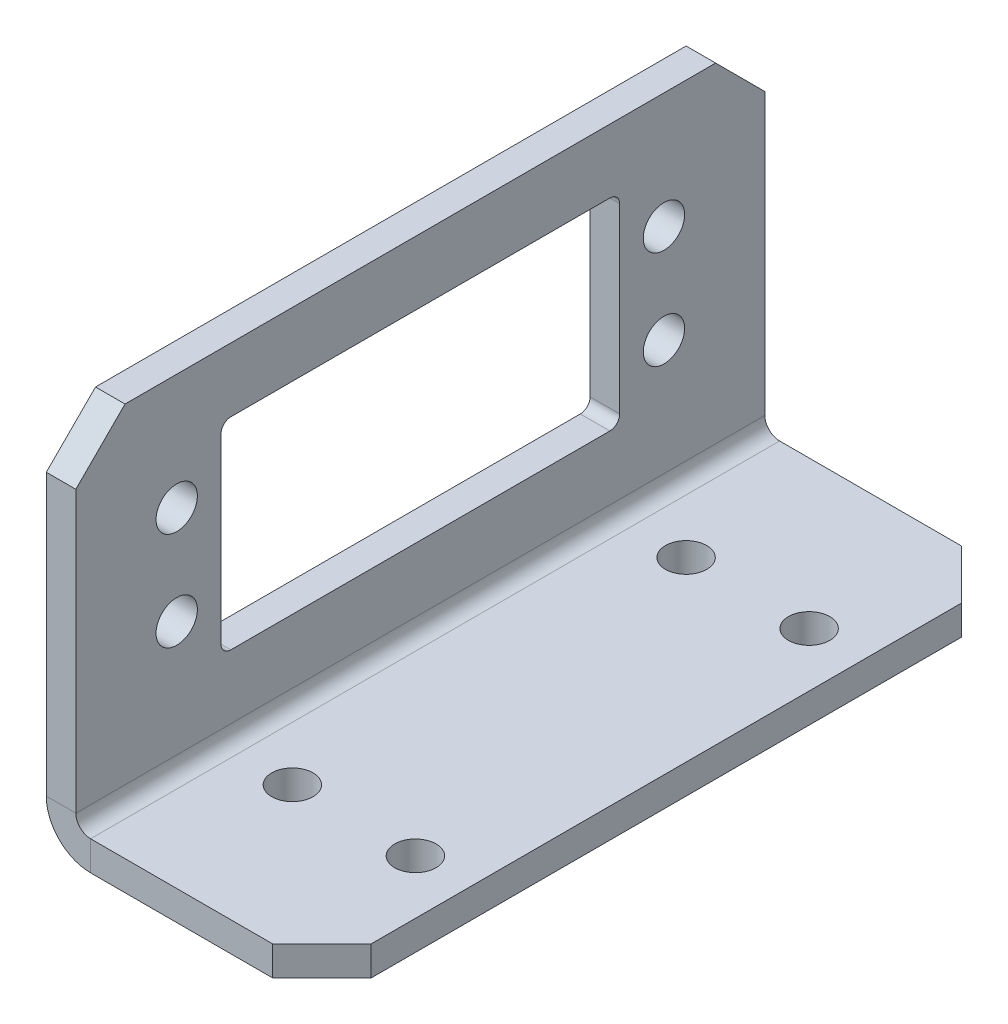
from build123d import *

# Parameters (mm, degrees)
SM_BASE_FLANGE_1_DEPTH = 70
CUT_EXTRUDE_7_REACH    = 79.105
SKETCH_18_W            = 40.5
SKETCH_18_H            = 20.5
CUT_EXTRUDE_8_REACH    = 79.105
SKETCH_19_R            = 2.1
FILLET_2_R             = 1
CUT_EXTRUDE_9_REACH    = 81.783
SKETCH_20_R            = 2.1
CHAMFER_3_SIZE         = 5


# Sheet-metal steps are written as plain solids
with BuildPart() as part:
    # Sketch 1 → 基材-凸緣1 (new body)
    with BuildSketch(Plane.XY):
        with BuildLine():
            Line((-12.5, 17.5), (-12.5, -16))
            ThreePointArc((-12.5, -16), (-12.060660172, -17.060660172), (-11, -17.5))
            Line((-11, -17.5), (12.5, -17.5))
            Line((12.5, -17.5), (12.5, -20.5))
            Line((12.5, -20.5), (-11, -20.5))
            ThreePointArc((-11, -20.5), (-14.181980515, -19.181980515), (-15.5, -16))
            Line((-15.5, -16), (-15.5, 17.5))
            Line((-15.5, 17.5), (-12.5, 17.5))
        make_face()
    extrude(amount=SM_BASE_FLANGE_1_DEPTH)

    # 草圖18 → 除料-伸長7 (cut, up to next)
    with BuildSketch(Plane(origin=(-12.5, 0, 0), x_dir=(0, 0, -1), z_dir=(1, 0, 0)), mode=Mode.PRIVATE) as cut_extrude_7_sk1:
        with Locations((-35, 0.75)):
            Rectangle(SKETCH_18_W, SKETCH_18_H)
    cut_extrude_7_tool1 = extrude(cut_extrude_7_sk1.sketch, amount=-CUT_EXTRUDE_7_REACH, mode=Mode.PRIVATE) & part.part
    add(cut_extrude_7_tool1.solids().sort_by_distance((-12.5, 0.75, 35))[0], mode=Mode.SUBTRACT)

    # 草圖19 → 除料-伸長8 (cut, up to next)
    with BuildSketch(Plane(origin=(-12.5, 0, 0), x_dir=(0, 0, -1), z_dir=(1, 0, 0)), mode=Mode.PRIVATE) as cut_extrude_8_sk1:
        with Locations(Location((-10.25, 5.75, 0), (0, 0, 90))):
            Circle(SKETCH_19_R)
    cut_extrude_8_tool1 = extrude(cut_extrude_8_sk1.sketch, amount=-CUT_EXTRUDE_8_REACH, mode=Mode.PRIVATE) & part.part
    # 草圖19 → 除料-伸長8 (cut, up to next)
    with BuildSketch(Plane(origin=(-12.5, 0, 0), x_dir=(0, 0, -1), z_dir=(1, 0, 0)), mode=Mode.PRIVATE) as cut_extrude_8_sk2:
        with Locations(Location((-10.25, -4.25, 0), (0, 0, 90))):
            Circle(SKETCH_19_R)
    cut_extrude_8_tool2 = extrude(cut_extrude_8_sk2.sketch, amount=-CUT_EXTRUDE_8_REACH, mode=Mode.PRIVATE) & part.part
    # 草圖19 → 除料-伸長8 (cut, up to next)
    with BuildSketch(Plane(origin=(-12.5, 0, 0), x_dir=(0, 0, -1), z_dir=(1, 0, 0)), mode=Mode.PRIVATE) as cut_extrude_8_sk3:
        with Locations(Location((-59.75, -4.25, 0), (0, 0, 90))):
            Circle(SKETCH_19_R)
    cut_extrude_8_tool3 = extrude(cut_extrude_8_sk3.sketch, amount=-CUT_EXTRUDE_8_REACH, mode=Mode.PRIVATE) & part.part
    # 草圖19 → 除料-伸長8 (cut, up to next)
    with BuildSketch(Plane(origin=(-12.5, 0, 0), x_dir=(0, 0, -1), z_dir=(1, 0, 0)), mode=Mode.PRIVATE) as cut_extrude_8_sk4:
        with Locations(Location((-59.75, 5.75, 0), (0, 0, 90))):
            Circle(SKETCH_19_R)
    cut_extrude_8_tool4 = extrude(cut_extrude_8_sk4.sketch, amount=-CUT_EXTRUDE_8_REACH, mode=Mode.PRIVATE) & part.part
    add(cut_extrude_8_tool1.solids().sort_by_distance((-12.5, 5.75, 10.25))[0], mode=Mode.SUBTRACT)
    add(cut_extrude_8_tool2.solids().sort_by_distance((-12.5, -4.25, 10.25))[0], mode=Mode.SUBTRACT)
    add(cut_extrude_8_tool3.solids().sort_by_distance((-12.5, -4.25, 59.75))[0], mode=Mode.SUBTRACT)
    add(cut_extrude_8_tool4.solids().sort_by_distance((-12.5, 5.75, 59.75))[0], mode=Mode.SUBTRACT)

    # 圓角2
    fillet_2_edges = [part.edges().sort_by_distance(p)[0] for p in [
        (-14, 11, 14.75),
        (-14, -9.5, 14.75),
        (-14, -9.5, 55.25),
        (-14, 11, 55.25),
    ]]
    fillet(fillet_2_edges, radius=FILLET_2_R)

    # 草圖20 → 除料-伸長9 (cut, up to next)
    with BuildSketch(Plane(origin=(0, -17.5, 0), x_dir=(1, 0, 0), z_dir=(0, 1, 0)), mode=Mode.PRIVATE) as cut_extrude_9_sk1:
        with Locations(Location((-5.5, -15, 0), (0, 0, 270))):
            Circle(SKETCH_20_R)
    cut_extrude_9_tool1 = extrude(cut_extrude_9_sk1.sketch, amount=-CUT_EXTRUDE_9_REACH, mode=Mode.PRIVATE) & part.part
    # 草圖20 → 除料-伸長9 (cut, up to next)
    with BuildSketch(Plane(origin=(0, -17.5, 0), x_dir=(1, 0, 0), z_dir=(0, 1, 0)), mode=Mode.PRIVATE) as cut_extrude_9_sk2:
        with Locations(Location((7, -15, 0), (0, 0, 270))):
            Circle(SKETCH_20_R)
    cut_extrude_9_tool2 = extrude(cut_extrude_9_sk2.sketch, amount=-CUT_EXTRUDE_9_REACH, mode=Mode.PRIVATE) & part.part
    # 草圖20 → 除料-伸長9 (cut, up to next)
    with BuildSketch(Plane(origin=(0, -17.5, 0), x_dir=(1, 0, 0), z_dir=(0, 1, 0)), mode=Mode.PRIVATE) as cut_extrude_9_sk3:
        with Locations(Location((7, -55, 0), (0, 0, 270))):
            Circle(SKETCH_20_R)
    cut_extrude_9_tool3 = extrude(cut_extrude_9_sk3.sketch, amount=-CUT_EXTRUDE_9_REACH, mode=Mode.PRIVATE) & part.part
    # 草圖20 → 除料-伸長9 (cut, up to next)
    with BuildSketch(Plane(origin=(0, -17.5, 0), x_dir=(1, 0, 0), z_dir=(0, 1, 0)), mode=Mode.PRIVATE) as cut_extrude_9_sk4:
        with Locations(Location((-5.5, -55, 0), (0, 0, 270))):
            Circle(SKETCH_20_R)
    cut_extrude_9_tool4 = extrude(cut_extrude_9_sk4.sketch, amount=-CUT_EXTRUDE_9_REACH, mode=Mode.PRIVATE) & part.part
    add(cut_extrude_9_tool1.solids().sort_by_distance((-5.5, -17.5, 15))[0], mode=Mode.SUBTRACT)
    add(cut_extrude_9_tool2.solids().sort_by_distance((7, -17.5, 15))[0], mode=Mode.SUBTRACT)
    add(cut_extrude_9_tool3.solids().sort_by_distance((7, -17.5, 55))[0], mode=Mode.SUBTRACT)
    add(cut_extrude_9_tool4.solids().sort_by_distance((-5.5, -17.5, 55))[0], mode=Mode.SUBTRACT)

    # 導角3
    chamfer_3_edges = [part.edges().sort_by_distance(p)[0] for p in [
        (-14, 17.5, 70),
        (-14, 17.5, 0),
        (12.5, -19, 70),
        (12.5, -19, 0),
    ]]
    chamfer(chamfer_3_edges, length=CHAMFER_3_SIZE)


solid = part.part
